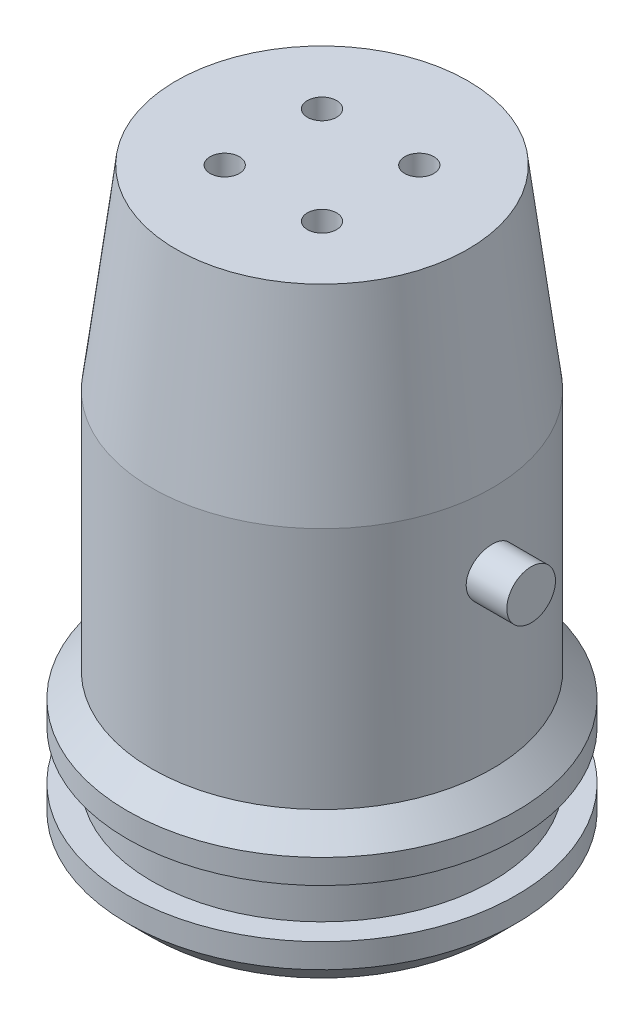
from build123d import *

# Parameters (mm, degrees)
SKETCH2_R           = 2.5
BOSS_EXTRUDE1_DEPTH = 7.5
SKETCH4_R           = 20
SKETCH4_R_2         = 17.5
BOSS_EXTRUDE3_DEPTH = 2.5
BOSS_EXTRUDE4_START = 2.5
SKETCH5_R           = 20
SKETCH5_R_2         = 17.5
BOSS_EXTRUDE4_DEPTH = 2.5
SKETCH6_R           = 1.5
CUT_EXTRUDE1_DEPTH  = 67.800074972
CIRPATTERN1_COUNT   = 4
SKETCH7_W           = 20
SKETCH7_H           = 10
CUT_EXTRUDE2_DEPTH  = 67.800074882
CHAMFER1_SIZE       = 2.5


with BuildPart() as part:
    # Sketch1 → Revolve1 (revolve)
    with BuildSketch(Plane.XY, mode=Mode.PRIVATE) as revolve1_sk:
        Polygon((15, 0), (17.5, 0), (17.5, 40), (15, 60), (0, 60), (0, 57), (12.875, 57), (15, 40), align=None)
    revolve(revolve1_sk.sketch.rotate(Axis((0, 0, 0), (0, 1, 0)), 90), axis=Axis((0, 0, 0), (0, 1, 0)))

    # Sketch2 → Boss-Extrude1 (add)
    with BuildSketch(Plane(origin=(14, 0, 0), x_dir=(0, 0, -1), z_dir=(1, 0, 0))):
        with Locations(Location((0, 32.5, 0), (0, 0, 180))):
            Circle(SKETCH2_R)
    extrude(amount=BOSS_EXTRUDE1_DEPTH)

    # Sketch4 → Boss-Extrude3 (add)
    with BuildSketch(Plane(origin=(0, 5, 0), x_dir=(1, 0, 0), z_dir=(0, 1, 0))):
        with Locations(Location((0, 0, 0), (0, 0, 270))):
            Circle(SKETCH4_R)
        with Locations(Location((0, 0, 0), (0, 0, 90))):
            Circle(SKETCH4_R_2, mode=Mode.SUBTRACT)
    extrude(amount=-BOSS_EXTRUDE3_DEPTH)

    # Sketch5 → Boss-Extrude4 (add)
    with BuildSketch(Plane(origin=(0, 10, 0), x_dir=(1, 0, 0), z_dir=(0, 1, 0)).offset(BOSS_EXTRUDE4_START)):
        with Locations(Location((0, 0, 0), (0, 0, 270))):
            Circle(SKETCH5_R)
        with Locations(Location((0, 0, 0), (0, 0, 270))):
            Circle(SKETCH5_R_2, mode=Mode.SUBTRACT)
    extrude(amount=-BOSS_EXTRUDE4_DEPTH)

    # Sketch6 → Cut-Extrude1 (cut, through all)
    with BuildSketch(Plane(origin=(0, 60, 0), x_dir=(1, 0, 0), z_dir=(0, 1, 0))):
        with Locations(Location((-5, 5, 0), (0, 0, 270))):
            Circle(SKETCH6_R)
    cut_extrude1 = extrude(amount=-CUT_EXTRUDE1_DEPTH, mode=Mode.SUBTRACT)

    # CirPattern1: Cut-Extrude1 ×4 about axis
    cirpattern1_axis = Axis((0, 0, 0), (0, 1, 0))
    for i in range(1, CIRPATTERN1_COUNT):
        add(cut_extrude1.rotate(cirpattern1_axis, i * 360 / CIRPATTERN1_COUNT), mode=Mode.SUBTRACT)

    # Sketch7 → Cut-Extrude2 (cut, through all)
    with BuildSketch(Plane.XY):
        with Locations((0, 32.5)):
            Rectangle(SKETCH7_W, SKETCH7_H)
    extrude(amount=-CUT_EXTRUDE2_DEPTH, mode=Mode.SUBTRACT)

    # Chamfer1
    chamfer1_edges = [part.edges().sort_by_distance(p)[0] for p in [
        (0, 2.5, 17.5),
        (0, 12.5, 17.5),
    ]]
    chamfer(chamfer1_edges, length=CHAMFER1_SIZE - 0.0001)  # a hair under: the kernel refuses the full size


solid = part.part
